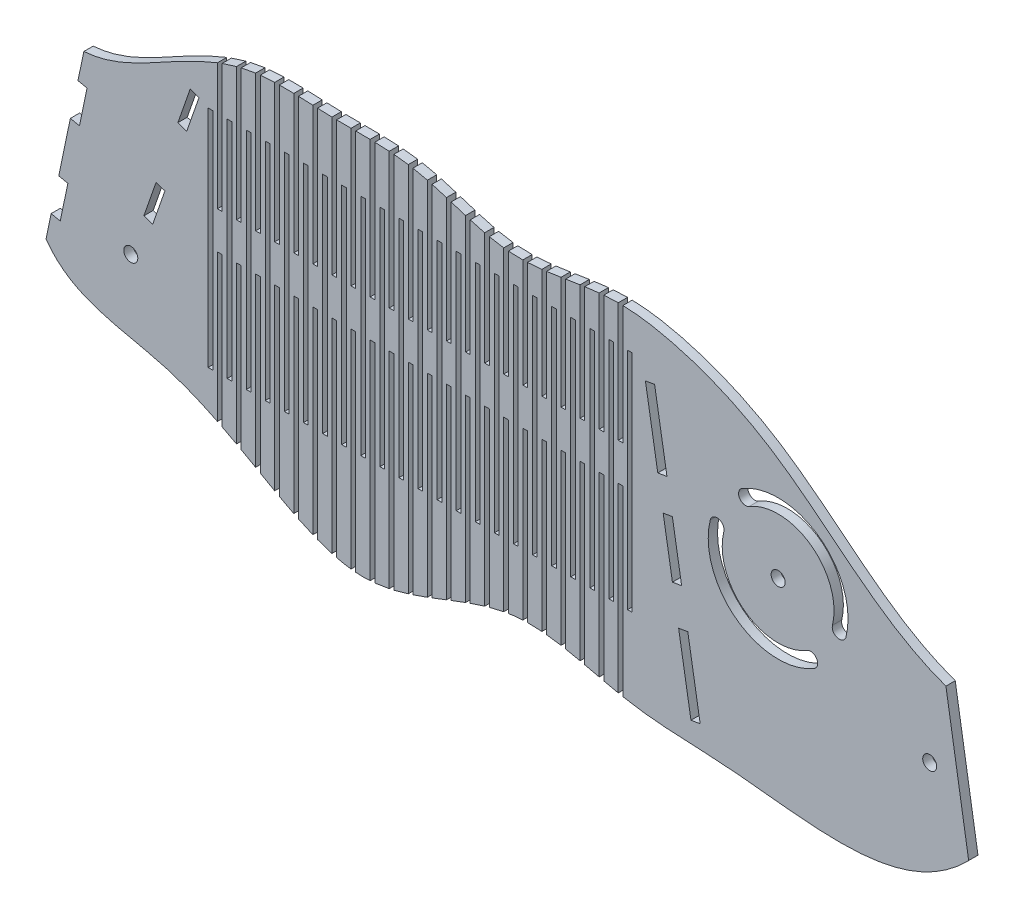
from build123d import *

# Parameters (mm, degrees)
SKETCH1_R           = 2.38125
BOSS_EXTRUDE1_DEPTH = 3.175
CUT_EXTRUDE1_DEPTH  = 5.08
CUT_EXTRUDE2_DEPTH  = 5.08
SKETCH5_R           = 2.38125
CUT_EXTRUDE3_DEPTH  = 3.175
SKETCH6_R           = 2.38125
CUT_EXTRUDE4_DEPTH  = 3.175
CAVITY1_START       = 356.034163388
CAVITY1_OUTLINE_W   = 3.175
CAVITY1_OUTLINE_H   = 3.175
CAVITY1_DEPTH       = 12.7
CAVITY1_START_2     = 391.291479466
CAVITY1_2_OUTLINE_W = 3.175
CAVITY1_2_OUTLINE_H = 3.175
CAVITY1_2_DEPTH     = 12.7
CAVITY2_START       = -223.472188214
CAVITY2_OUTLINE_W   = 3.175
CAVITY2_OUTLINE_H   = 3.175
CAVITY2_DEPTH       = 25.4
CAVITY2_START_2     = -155.235549336
CAVITY2_2_OUTLINE_W = 3.175
CAVITY2_2_OUTLINE_H = 3.175
CAVITY2_2_DEPTH     = 25.4
CAVITY2_START_3     = -186.985549336
CAVITY2_3_OUTLINE_W = 3.175
CAVITY2_3_OUTLINE_H = 3.175
CAVITY2_3_DEPTH     = 19.05
SKETCH9_W           = 1.5875
SKETCH9_H           = 76.537210747
CUT_EXTRUDE5_DEPTH  = 3.175


# Read off the part's stored shape, not the designer's step: Cavity1, Cavity2
with BuildPart() as part:
    # Sketch1 → Boss-Extrude1 (new body)
    with BuildSketch(Plane.XY):
        with BuildLine():
            Line((269.916445409, 253.652399792), (278.652265274, 308.805411772))
            add(Edge.make_bspline(
                [(278.652265274, 308.805411772), (290.692161073, 306.589475047), (311.338850433, 317.335091922), (340.236506307, 333.719378013), (371.054971243, 330.491238026), (400.811790222, 332.322146981), (432.011124299, 316.885943617), (462.237658712, 327.456126434), (492.71380688, 322.24694493), (532.367725491, 304.981517421), (556.314795109, 276.410246833), (580.070243253, 267.986601994)],
                knots=[0, 0, 0, 0, 0.106756345, 0.213119844, 0.299137831, 0.38743389, 0.488570323, 0.604473522, 0.666037588, 0.77282929, 1, 1, 1, 1], degree=3))
            Line((580.070243253, 267.986601994), (587.820428198, 220.400466428))
            add(Edge.make_bspline(
                [(269.916445409, 253.652399792), (277.364011147, 233.640536162), (309.097579981, 234.069368965), (345.25213434, 215.321322945), (385.309708174, 190.516200502), (428.876890705, 223.285910499), (470.617284064, 207.506422317), (522.560085696, 207.927604228), (564.59114382, 196.534310532), (587.820428198, 220.400466428)],
                knots=[0, 0, 0, 0, 0.155676432, 0.249085855, 0.36882305, 0.53529964, 0.647794575, 0.742561856, 1, 1, 1, 1], degree=3))
        make_face()
        with Locations((302.440577305, 256.532151525)):
            Circle(SKETCH1_R, mode=Mode.SUBTRACT)
    extrude(amount=BOSS_EXTRUDE1_DEPTH)

    # Sketch3 → Cut-Extrude1 (cut)
    with BuildSketch(Plane.XY.offset(3.175)):
        with BuildLine():
            Line((273.561406627, 246.609599812), (286.450487232, 308.373338769))
            add(Edge.make_bspline(
                [(286.450487232, 308.373338769), (283.9226769, 308.195649502), (281.329436573, 308.31267975), (278.652265274, 308.805411772)],
                knots=[0.976261836, 0.976261836, 0.976261836, 0.976261836, 1, 1, 1, 1], degree=3))
            Line((278.652265274, 308.805411772), (269.916445409, 253.652399792))
            add(Edge.make_bspline(
                [(269.916445409, 253.652399792), (270.919272736, 250.957768497), (272.146664907, 248.630833297), (273.561406627, 246.609599812)],
                knots=[0, 0, 0, 0, 0.020962095, 0.020962095, 0.020962095, 0.020962095], degree=3))
        make_face()
    extrude(amount=-CUT_EXTRUDE1_DEPTH, mode=Mode.SUBTRACT)

    # Sketch4 → Cut-Extrude2 (cut)
    with BuildSketch(Plane.XY.offset(3.175)):
        Polygon((275.307666463, 254.977577361), (278.415711742, 254.328979222), (281.010104298, 266.761160336), (277.90205902, 267.409758476), align=None)
        Polygon((281.852433987, 286.339729938), (284.960479266, 285.691131799), (287.554871822, 298.123312913), (284.446826544, 298.771911052), align=None)
    extrude(amount=-CUT_EXTRUDE2_DEPTH, mode=Mode.SUBTRACT)

    # Sketch5 → Cut-Extrude3 (cut)
    with BuildSketch(Plane(origin=(0, 0, 0), x_dir=(-1, 0, 0), z_dir=(0, 0, -1))):
        with Locations((-522.920243253, 271.161601994)):
            Circle(SKETCH5_R)
        with BuildLine():
            ThreePointArc((-510.596975391, 291.537377451), (-537.029094713, 290.344288634), (-546.041958521, 265.467619268))
            ThreePointArc((-546.041958521, 265.467619268), (-543.160388722, 263.724846014), (-541.417615468, 266.606415813))
            ThreePointArc((-541.417615468, 266.606415813), (-534.207324421, 286.507751306), (-513.061628964, 287.46222236))
            ThreePointArc((-513.061628964, 287.46222236), (-509.791724632, 288.267473119), (-510.596975391, 291.537377451))
        make_face()
        with BuildLine():
            ThreePointArc((-535.243511114, 250.785826538), (-508.811391792, 251.978915355), (-499.798527984, 276.855584721))
            ThreePointArc((-499.798527984, 276.855584721), (-502.680097784, 278.598357975), (-504.422871038, 275.716788175))
            ThreePointArc((-504.422871038, 275.716788175), (-511.633162084, 255.815452683), (-532.778857542, 254.860981629))
            ThreePointArc((-532.778857542, 254.860981629), (-536.048761874, 254.055730869), (-535.243511114, 250.785826538))
        make_face()
    extrude(amount=-CUT_EXTRUDE3_DEPTH, mode=Mode.SUBTRACT)

    # Sketch6 → Cut-Extrude4 (cut)
    with BuildSketch(Plane.XY.offset(3.175)):
        with Locations((574.544204444, 242.662405338)):
            Circle(SKETCH6_R)
    extrude(amount=-CUT_EXTRUDE4_DEPTH, mode=Mode.SUBTRACT)

    # Cavity1 outline → Cavity1 (cut)
    with BuildSketch(Plane(origin=(0, 0, 0), x_dir=(0.9443237299357901, -0.32901777015863004, 0), z_dir=(0.32901777015863004, 0.9443237299357901, 0)).offset(CAVITY1_START)):
        with Locations((202.520154002, -1.5875)):
            Rectangle(CAVITY1_OUTLINE_W, CAVITY1_OUTLINE_H)
    extrude(amount=CAVITY1_DEPTH, mode=Mode.SUBTRACT)

    # Cavity1 2 outline → Cavity1 2 (cut)
    with BuildSketch(Plane(origin=(0, 0, 0), x_dir=(0.9443237299357901, -0.32901777015863004, 0), z_dir=(0.32901777015863004, 0.9443237299357901, 0)).offset(CAVITY1_START_2)):
        with Locations((202.520154002, -1.5875)):
            Rectangle(CAVITY1_2_OUTLINE_W, CAVITY1_2_OUTLINE_H)
    extrude(amount=CAVITY1_2_DEPTH, mode=Mode.SUBTRACT)

    # Cavity2 outline → Cavity2 (cut)
    with BuildSketch(Plane(origin=(0, 0, 0), x_dir=(0.9861849009695607, 0.165648245084751, 0), z_dir=(0.16564824508475098, -0.9861849009695608, 0)).offset(CAVITY2_START)):
        with Locations((523.537508725, 1.5875)):
            Rectangle(CAVITY2_OUTLINE_W, CAVITY2_OUTLINE_H)
    extrude(amount=CAVITY2_DEPTH, mode=Mode.SUBTRACT)

    # Cavity2 2 outline → Cavity2 2 (cut)
    with BuildSketch(Plane(origin=(0, 0, 0), x_dir=(0.9861849009695607, 0.165648245084751, 0), z_dir=(0.16564824508475098, -0.9861849009695608, 0)).offset(CAVITY2_START_2)):
        with Locations((523.537508725, 1.5875)):
            Rectangle(CAVITY2_2_OUTLINE_W, CAVITY2_2_OUTLINE_H)
    extrude(amount=CAVITY2_2_DEPTH, mode=Mode.SUBTRACT)

    # Cavity2 3 outline → Cavity2 3 (cut)
    with BuildSketch(Plane(origin=(0, 0, 0), x_dir=(0.9861849009695607, 0.165648245084751, 0), z_dir=(0.16564824508475098, -0.9861849009695608, 0)).offset(CAVITY2_START_3)):
        with Locations((523.537508725, 1.5875)):
            Rectangle(CAVITY2_3_OUTLINE_W, CAVITY2_3_OUTLINE_H)
    extrude(amount=CAVITY2_3_DEPTH, mode=Mode.SUBTRACT)

    # Sketch9 → Cut-Extrude5 (cut)
    with BuildSketch(Plane.XY.offset(3.175)):
        with Locations((329.567272583, 274.590734941)):
            Rectangle(SKETCH9_W, SKETCH9_H)
        with BuildLine():
            Line((331.948522583, 272.013398299), (331.948522583, 221.979997018))
            add(Edge.make_bspline(
                [(331.948522583, 221.979997018), (332.478289299, 221.716571812), (333.007376965, 221.449732897), (333.536022583, 221.179701538)],
                knots=[0.212596369, 0.212596369, 0.212596369, 0.212596369, 0.217845379, 0.217845379, 0.217845379, 0.217845379], degree=3))
            Line((333.536022583, 221.179701538), (333.536022583, 272.013398299))
            Line((333.536022583, 272.013398299), (331.948522583, 272.013398299))
        make_face()
        with BuildLine():
            Line((338.44929923, 272.013398299), (338.44929923, 218.58157118))
            add(Edge.make_bspline(
                [(338.44929923, 218.58157118), (338.97809291, 218.293532558), (339.507180303, 218.002981984), (340.03679923, 217.710141493)],
                knots=[0.234125777, 0.234125777, 0.234125777, 0.234125777, 0.239380851, 0.239380851, 0.239380851, 0.239380851], degree=3))
            Line((340.03679923, 217.710141493), (340.03679923, 272.013398299))
            Line((340.03679923, 272.013398299), (338.44929923, 272.013398299))
        make_face()
        with BuildLine():
            Line((344.950075877, 272.013398299), (344.950075877, 214.947650647))
            add(Edge.make_bspline(
                [(344.950075877, 214.947650647), (345.478335911, 214.647238655), (346.007511163, 214.34584242), (346.537575877, 214.04414377)],
                knots=[0.255559988, 0.255559988, 0.255559988, 0.255559988, 0.260751336, 0.260751336, 0.260751336, 0.260751336], degree=3))
            Line((346.537575877, 214.04414377), (346.537575877, 272.013398299))
            Line((346.537575877, 272.013398299), (344.950075877, 272.013398299))
        make_face()
        with BuildLine():
            Line((351.450852523, 272.013398299), (351.450852523, 211.272804214))
            add(Edge.make_bspline(
                [(351.450852523, 211.272804214), (351.979237946, 210.979523007), (352.508412871, 210.687989577), (353.038352523, 210.398859707)],
                knots=[0.27671133, 0.27671133, 0.27671133, 0.27671133, 0.281835714, 0.281835714, 0.281835714, 0.281835714], degree=3))
            Line((353.038352523, 210.398859707), (353.038352523, 272.013398299))
            Line((353.038352523, 272.013398299), (351.450852523, 272.013398299))
        make_face()
        with BuildLine():
            Line((357.95162917, 272.013398299), (357.95162917, 207.817073956))
            add(Edge.make_bspline(
                [(357.95162917, 207.817073956), (358.480130477, 207.55191203), (359.009305131, 207.291074407), (359.53912917, 207.035195351)],
                knots=[0.297604736, 0.297604736, 0.297604736, 0.297604736, 0.302672447, 0.302672447, 0.302672447, 0.302672447], degree=3))
            Line((359.53912917, 207.035195351), (359.53912917, 272.013398299))
            Line((359.53912917, 272.013398299), (357.95162917, 272.013398299))
        make_face()
        with BuildLine():
            Line((364.452405817, 272.013398299), (364.452405817, 204.830553886))
            add(Edge.make_bspline(
                [(364.452405817, 204.830553886), (364.981015372, 204.613285682), (365.510189804, 204.402800939), (366.039905817, 204.199716299)],
                knots=[0.31828075, 0.31828075, 0.31828075, 0.31828075, 0.323301095, 0.323301095, 0.323301095, 0.323301095], degree=3))
            Line((366.039905817, 204.199716299), (366.039905817, 272.013398299))
            Line((366.039905817, 272.013398299), (364.452405817, 272.013398299))
        make_face()
        with BuildLine():
            add(Edge.make_bspline(
                [(331.948522583, 327.781918128), (332.476402121, 327.98584286), (333.005536374, 328.18359917), (333.536022583, 328.374679349)],
                knots=[0.176971561, 0.176971561, 0.176971561, 0.176971561, 0.182261004, 0.182261004, 0.182261004, 0.182261004], degree=3))
            Line((331.948522583, 327.781918128), (331.948522583, 284.713398299))
            Line((331.948522583, 284.713398299), (333.536022583, 284.713398299))
            Line((333.536022583, 284.713398299), (333.536022583, 328.374679349))
        make_face()
        with BuildLine():
            Line((370.953182464, 272.013398299), (370.953182464, 202.550703177))
            add(Edge.make_bspline(
                [(370.953182464, 202.550703177), (371.481894184, 202.400271833), (372.011068437, 202.258998048), (372.540682464, 202.127484268)],
                knots=[0.338776222, 0.338776222, 0.338776222, 0.338776222, 0.343757732, 0.343757732, 0.343757732, 0.343757732], degree=3))
            Line((372.540682464, 202.127484268), (372.540682464, 272.013398299))
            Line((372.540682464, 272.013398299), (370.953182464, 272.013398299))
        make_face()
        with BuildLine():
            add(Edge.make_bspline(
                [(338.44929923, 329.927424416), (338.976859185, 330.069600473), (339.505995572, 330.203911393), (340.03679923, 330.3298829)],
                knots=[0.198455355, 0.198455355, 0.198455355, 0.198455355, 0.203626046, 0.203626046, 0.203626046, 0.203626046], degree=3))
            Line((338.44929923, 329.927424416), (338.44929923, 284.713398299))
            Line((338.44929923, 284.713398299), (340.03679923, 284.713398299))
            Line((340.03679923, 284.713398299), (340.03679923, 330.3298829))
        make_face()
        with BuildLine():
            Line((377.45395911, 272.013398299), (377.45395911, 201.20670015))
            add(Edge.make_bspline(
                [(377.45395911, 201.20670015), (377.982768231, 201.141543243), (378.511942344, 201.087861077), (379.04145911, 201.046244951)],
                knots=[0.359125101, 0.359125101, 0.359125101, 0.359125101, 0.364075702, 0.364075702, 0.364075702, 0.364075702], degree=3))
            Line((379.04145911, 201.046244951), (379.04145911, 272.013398299))
            Line((379.04145911, 272.013398299), (377.45395911, 272.013398299))
        make_face()
        with BuildLine():
            add(Edge.make_bspline(
                [(344.950075877, 331.239502044), (345.477686913, 331.310015282), (346.006892604, 331.372619256), (346.537575877, 331.427980811)],
                knots=[0.219421179, 0.219421179, 0.219421179, 0.219421179, 0.22445911, 0.22445911, 0.22445911, 0.22445911], degree=3))
            Line((344.950075877, 331.239502044), (344.950075877, 284.713398299))
            Line((344.950075877, 284.713398299), (346.537575877, 284.713398299))
            Line((346.537575877, 284.713398299), (346.537575877, 331.427980811))
        make_face()
        with BuildLine():
            Line((383.954735757, 272.013398299), (383.954735757, 201.010740085))
            add(Edge.make_bspline(
                [(383.954735757, 201.010740085), (384.4835923, 201.0432421), (385.012760033, 201.086775203), (385.542235757, 201.14064912)],
                knots=[0.379358514, 0.379358514, 0.379358514, 0.379358514, 0.384284438, 0.384284438, 0.384284438, 0.384284438], degree=3))
            Line((385.542235757, 201.14064912), (385.542235757, 272.013398299))
            Line((385.542235757, 272.013398299), (383.954735757, 272.013398299))
        make_face()
        with BuildLine():
            add(Edge.make_bspline(
                [(351.450852523, 331.751972157), (351.978980116, 331.768895291), (352.508183567, 331.780818892), (353.038352523, 331.788371538)],
                knots=[0.239885944, 0.239885944, 0.239885944, 0.239885944, 0.244825602, 0.244825602, 0.244825602, 0.244825602], degree=3))
            Line((351.450852523, 331.751972157), (351.450852523, 284.713398299))
            Line((351.450852523, 284.713398299), (353.038352523, 284.713398299))
            Line((353.038352523, 284.713398299), (353.038352523, 331.788371538))
        make_face()
        with BuildLine():
            Line((390.455512404, 272.013398299), (390.455512404, 201.915127832))
            add(Edge.make_bspline(
                [(390.455512404, 201.915127832), (390.984384788, 202.025761457), (391.513552507, 202.14452825), (392.043012404, 202.270747538)],
                knots=[0.399494137, 0.399494137, 0.399494137, 0.399494137, 0.404397119, 0.404397119, 0.404397119, 0.404397119], degree=3))
            Line((392.043012404, 202.270747538), (392.043012404, 272.013398299))
            Line((392.043012404, 272.013398299), (390.455512404, 272.013398299))
        make_face()
        with BuildLine():
            add(Edge.make_bspline(
                [(357.95162917, 331.752373778), (358.480220074, 331.739155679), (359.009422206, 331.723557468), (359.53912917, 331.706185191)],
                knots=[0.260009782, 0.260009782, 0.260009782, 0.260009782, 0.264889698, 0.264889698, 0.264889698, 0.264889698], degree=3))
            Line((357.95162917, 331.752373778), (357.95162917, 284.713398299))
            Line((357.95162917, 284.713398299), (359.53912917, 284.713398299))
            Line((359.53912917, 284.713398299), (359.53912917, 331.706185191))
        make_face()
        with BuildLine():
            Line((396.956289051, 272.013398299), (396.956289051, 203.633224381))
            add(Edge.make_bspline(
                [(396.956289051, 203.633224381), (397.485176815, 203.798247993), (398.01434452, 203.96857497), (398.543789051, 204.143533619)],
                knots=[0.419537816, 0.419537816, 0.419537816, 0.419537816, 0.42441914, 0.42441914, 0.42441914, 0.42441914], degree=3))
            Line((398.543789051, 204.143533619), (398.543789051, 272.013398299))
            Line((398.543789051, 272.013398299), (396.956289051, 272.013398299))
        make_face()
        with BuildLine():
            add(Edge.make_bspline(
                [(364.452405817, 331.512565298), (364.981432615, 331.490132848), (365.510634194, 331.467794822), (366.039905817, 331.446147804)],
                knots=[0.279942862, 0.279942862, 0.279942862, 0.279942862, 0.284797248, 0.284797248, 0.284797248, 0.284797248], degree=3))
            Line((364.452405817, 331.512565298), (364.452405817, 284.713398299))
            Line((364.452405817, 284.713398299), (366.039905817, 284.713398299))
            Line((366.039905817, 284.713398299), (366.039905817, 331.446147804))
        make_face()
        with BuildLine():
            Line((403.457065697, 272.013398299), (403.457065697, 205.877321436))
            add(Edge.make_bspline(
                [(403.457065697, 205.877321436), (403.985968416, 206.073657504), (404.515136108, 206.272529414), (405.044565697, 206.473273865)],
                knots=[0.439494736, 0.439494736, 0.439494736, 0.439494736, 0.444355639, 0.444355639, 0.444355639, 0.444355639], degree=3))
            Line((405.044565697, 206.473273865), (405.044565697, 272.013398299))
            Line((405.044565697, 272.013398299), (403.457065697, 272.013398299))
        make_face()
        with BuildLine():
            add(Edge.make_bspline(
                [(370.953182464, 331.282694848), (371.482601919, 331.271002029), (372.01177757, 331.261694939), (372.540682464, 331.254245337)],
                knots=[0.299821824, 0.299821824, 0.299821824, 0.299821824, 0.304682785, 0.304682785, 0.304682785, 0.304682785], degree=3))
            Line((370.953182464, 331.282694848), (370.953182464, 284.713398299))
            Line((370.953182464, 284.713398299), (372.540682464, 284.713398299))
            Line((372.540682464, 284.713398299), (372.540682464, 331.254245337))
        make_face()
        with BuildLine():
            Line((409.957842344, 272.013398299), (409.957842344, 208.367487698))
            add(Edge.make_bspline(
                [(409.957842344, 208.367487698), (410.486759621, 208.572656714), (411.015927301, 208.77765088), (411.545342344, 208.981814737)],
                knots=[0.459369887, 0.459369887, 0.459369887, 0.459369887, 0.464211558, 0.464211558, 0.464211558, 0.464211558], degree=3))
            Line((411.545342344, 208.981814737), (411.545342344, 272.013398299))
            Line((411.545342344, 272.013398299), (409.957842344, 272.013398299))
        make_face()
        with BuildLine():
            add(Edge.make_bspline(
                [(377.45395911, 331.222772669), (377.983492722, 331.221759023), (378.512668505, 331.220966428), (379.04145911, 331.219858884)],
                knots=[0.319761203, 0.319761203, 0.319761203, 0.319761203, 0.32464585, 0.32464585, 0.32464585, 0.32464585], degree=3))
            Line((377.45395911, 331.222772669), (377.45395911, 284.713398299))
            Line((377.45395911, 284.713398299), (379.04145911, 284.713398299))
            Line((379.04145911, 284.713398299), (379.04145911, 331.219858884))
        make_face()
        with BuildLine():
            Line((416.458618991, 272.013398299), (416.458618991, 210.830784546))
            add(Edge.make_bspline(
                [(416.458618991, 210.830784546), (416.987550461, 211.022843739), (417.51671813, 211.212069118), (418.046118991, 211.397812543)],
                knots=[0.479168077, 0.479168077, 0.479168077, 0.479168077, 0.483991666, 0.483991666, 0.483991666, 0.483991666], degree=3))
            Line((418.046118991, 211.397812543), (418.046118991, 272.013398299))
            Line((418.046118991, 272.013398299), (416.458618991, 272.013398299))
        make_face()
        with BuildLine():
            add(Edge.make_bspline(
                [(383.954735757, 331.184394384), (384.48438812, 331.176109504), (385.013564087, 331.165818995), (385.542235757, 331.152976033)],
                knots=[0.339811292, 0.339811292, 0.339811292, 0.339811292, 0.344728592, 0.344728592, 0.344728592, 0.344728592], degree=3))
            Line((383.954735757, 331.184394384), (383.954735757, 284.713398299))
            Line((383.954735757, 284.713398299), (385.542235757, 284.713398299))
            Line((385.542235757, 284.713398299), (385.542235757, 331.152976033))
        make_face()
        with BuildLine():
            Line((422.959395638, 272.013398299), (422.959395638, 213.000537268))
            add(Edge.make_bspline(
                [(422.959395638, 213.000537268), (423.488340962, 213.158023528), (424.01750862, 213.310063953), (424.546895638, 213.456017218)],
                knots=[0.49889395, 0.49889395, 0.49889395, 0.49889395, 0.503700567, 0.503700567, 0.503700567, 0.503700567], degree=3))
            Line((424.546895638, 213.456017218), (424.546895638, 272.013398299))
            Line((424.546895638, 272.013398299), (422.959395638, 272.013398299))
        make_face()
        with BuildLine():
            add(Edge.make_bspline(
                [(390.455512404, 330.942883131), (390.985289809, 330.908603478), (391.514466018, 330.86999874), (392.043012404, 330.82650789)],
                knots=[0.36000967, 0.36000967, 0.36000967, 0.36000967, 0.364969186, 0.364969186, 0.364969186, 0.364969186], degree=3))
            Line((390.455512404, 330.942883131), (390.455512404, 284.713398299))
            Line((390.455512404, 284.713398299), (392.043012404, 284.713398299))
            Line((392.043012404, 284.713398299), (392.043012404, 330.82650789))
        make_face()
        with BuildLine():
            Line((429.460172284, 272.013398299), (429.460172284, 214.615655362))
            add(Edge.make_bspline(
                [(429.460172284, 214.615655362), (429.989131151, 214.717531904), (430.5182988, 214.811393016), (431.047672284, 214.896603718)],
                knots=[0.518551996, 0.518551996, 0.518551996, 0.518551996, 0.523342715, 0.523342715, 0.523342715, 0.523342715], degree=3))
            Line((431.047672284, 214.896603718), (431.047672284, 272.013398299))
            Line((431.047672284, 272.013398299), (429.460172284, 272.013398299))
        make_face()
        with BuildLine():
            add(Edge.make_bspline(
                [(396.956289051, 330.261922888), (397.486199762, 330.181764033), (398.015376277, 330.094832517), (398.543789051, 330.000549278)],
                knots=[0.380396671, 0.380396671, 0.380396671, 0.380396671, 0.385408772, 0.385408772, 0.385408772, 0.385408772], degree=3))
            Line((396.956289051, 330.261922888), (396.956289051, 284.713398299))
            Line((396.956289051, 284.713398299), (398.543789051, 284.713398299))
            Line((398.543789051, 284.713398299), (398.543789051, 330.000549278))
        make_face()
        with BuildLine():
            Line((435.960948931, 272.013398299), (435.960948931, 215.420263651))
            add(Edge.make_bspline(
                [(435.960948931, 215.420263651), (436.489925712, 215.446318858), (437.019095025, 215.462579503), (437.548448931, 215.469678935)],
                knots=[0.538146568, 0.538146568, 0.538146568, 0.538146568, 0.54292249, 0.54292249, 0.54292249, 0.54292249], degree=3))
            Line((437.548448931, 215.469678935), (437.548448931, 272.013398299))
            Line((437.548448931, 272.013398299), (435.960948931, 272.013398299))
        make_face()
        with BuildLine():
            add(Edge.make_bspline(
                [(403.457065697, 328.918054237), (403.986792458, 328.781685295), (404.515933436, 328.64001247), (405.044565697, 328.493947876)],
                knots=[0.401009703, 0.401009703, 0.401009703, 0.401009703, 0.406075263, 0.406075263, 0.406075263, 0.406075263], degree=3))
            Line((403.457065697, 328.918054237), (403.457065697, 284.713398299))
            Line((403.457065697, 284.713398299), (405.044565697, 284.713398299))
            Line((405.044565697, 284.713398299), (405.044565697, 328.493947876))
        make_face()
        with BuildLine():
            Line((442.461725578, 272.013398299), (442.461725578, 215.291669019))
            add(Edge.make_bspline(
                [(442.461725578, 215.291669019), (442.990735656, 215.248304858), (443.519904947, 215.197775196), (444.049225578, 215.140708347)],
                knots=[0.557683428, 0.557683428, 0.557683428, 0.557683428, 0.562446663, 0.562446663, 0.562446663, 0.562446663], degree=3))
            Line((444.049225578, 215.140708347), (444.049225578, 272.013398299))
            Line((444.049225578, 272.013398299), (442.461725578, 272.013398299))
        make_face()
        with BuildLine():
            add(Edge.make_bspline(
                [(409.957842344, 327.033176331), (410.487255497, 326.867629785), (411.016396005, 326.700505435), (411.545342344, 326.532732123)],
                knots=[0.421808556, 0.421808556, 0.421808556, 0.421808556, 0.426904897, 0.426904897, 0.426904897, 0.426904897], degree=3))
            Line((409.957842344, 327.033176331), (409.957842344, 284.713398299))
            Line((409.957842344, 284.713398299), (411.545342344, 284.713398299))
            Line((411.545342344, 284.713398299), (411.545342344, 326.532732123))
        make_face()
        with BuildLine():
            Line((448.962502224, 272.013398299), (448.962502224, 214.442573884))
            add(Edge.make_bspline(
                [(448.962502224, 214.442573884), (449.491545047, 214.351289135), (450.020714321, 214.255429336), (450.550002224, 214.155618764)],
                knots=[0.577172161, 0.577172161, 0.577172161, 0.577172161, 0.581925169, 0.581925169, 0.581925169, 0.581925169], degree=3))
            Line((450.550002224, 214.155618764), (450.550002224, 272.013398299))
            Line((450.550002224, 272.013398299), (448.962502224, 272.013398299))
        make_face()
        with BuildLine():
            add(Edge.make_bspline(
                [(416.458618991, 324.982223021), (416.987710319, 324.81916151), (417.516850738, 324.658333909), (418.046118991, 324.500672201)],
                knots=[0.442694989, 0.442694989, 0.442694989, 0.442694989, 0.447797066, 0.447797066, 0.447797066, 0.447797066], degree=3))
            Line((416.458618991, 324.982223021), (416.458618991, 284.713398299))
            Line((416.458618991, 284.713398299), (418.046118991, 284.713398299))
            Line((418.046118991, 284.713398299), (418.046118991, 324.500672201))
        make_face()
        with BuildLine():
            Line((455.463278871, 272.013398299), (455.463278871, 213.134820257))
            add(Edge.make_bspline(
                [(455.463278871, 213.134820257), (455.992354007, 213.016739909), (456.521523269, 212.89664586), (457.050778871, 212.775159311)],
                knots=[0.596622759, 0.596622759, 0.596622759, 0.596622759, 0.60136795, 0.60136795, 0.60136795, 0.60136795], degree=3))
            Line((457.050778871, 212.775159311), (457.050778871, 272.013398299))
            Line((457.050778871, 272.013398299), (455.463278871, 272.013398299))
        make_face()
        with BuildLine():
            add(Edge.make_bspline(
                [(422.959395638, 323.157092494), (423.488168006, 323.028398131), (424.017308727, 322.905703714), (424.546895638, 322.789930531)],
                knots=[0.463565608, 0.463565608, 0.463565608, 0.463565608, 0.468648094, 0.468648094, 0.468648094, 0.468648094], degree=3))
            Line((422.959395638, 323.157092494), (422.959395638, 284.713398299))
            Line((422.959395638, 284.713398299), (424.546895638, 284.713398299))
            Line((424.546895638, 284.713398299), (424.546895638, 322.789930531))
        make_face()
        with BuildLine():
            Line((461.964055518, 272.013398299), (461.964055518, 211.626286511))
            add(Edge.make_bspline(
                [(461.964055518, 211.626286511), (462.493162652, 211.502271341), (463.022331904, 211.378783857), (463.551555518, 211.256443124)],
                knots=[0.616045023, 0.616045023, 0.616045023, 0.616045023, 0.620784766, 0.620784766, 0.620784766, 0.620784766], degree=3))
            Line((463.551555518, 211.256443124), (463.551555518, 272.013398299))
            Line((463.551555518, 272.013398299), (461.964055518, 272.013398299))
        make_face()
        with BuildLine():
            add(Edge.make_bspline(
                [(429.460172284, 321.943483182), (429.906200433, 321.889650861), (430.43523677, 321.8339657), (430.96501147, 321.788631605), (431.047672284, 321.781808501)],
                knots=[0.48431779, 0.48431779, 0.48431779, 0.48431779, 0.488570323, 0.489356315, 0.489356315, 0.489356315, 0.489356315], degree=3))
            Line((429.460172284, 321.943483182), (429.460172284, 284.713398299))
            Line((429.460172284, 284.713398299), (431.047672284, 284.713398299))
            Line((431.047672284, 284.713398299), (431.047672284, 321.781808501))
        make_face()
        with BuildLine():
            Line((468.464832165, 272.013398299), (468.464832165, 210.172208721))
            add(Edge.make_bspline(
                [(468.464832165, 210.172208721), (468.993971093, 210.062960691), (469.523140341, 209.956770666), (470.052332165, 209.854256494)],
                knots=[0.635448612, 0.635448612, 0.635448612, 0.635448612, 0.640185252, 0.640185252, 0.640185252, 0.640185252], degree=3))
            Line((470.052332165, 209.854256494), (470.052332165, 272.013398299))
            Line((470.052332165, 272.013398299), (468.464832165, 272.013398299))
        make_face()
        with BuildLine():
            add(Edge.make_bspline(
                [(435.960948931, 321.645266952), (436.489532081, 321.656790838), (437.018711697, 321.675921485), (437.548448931, 321.701883188)],
                knots=[0.504866914, 0.504866914, 0.504866914, 0.504866914, 0.509854172, 0.509854172, 0.509854172, 0.509854172], degree=3))
            Line((435.960948931, 321.645266952), (435.960948931, 284.713398299))
            Line((435.960948931, 284.713398299), (437.548448931, 284.713398299))
            Line((437.548448931, 284.713398299), (437.548448931, 321.701883188))
        make_face()
        with BuildLine():
            add(Edge.make_bspline(
                [(442.461725578, 322.113940513), (442.990473675, 322.174181523), (443.519652998, 322.238795215), (444.049225578, 322.307023471)],
                knots=[0.52522669, 0.52522669, 0.52522669, 0.52522669, 0.530175968, 0.530175968, 0.530175968, 0.530175968], degree=3))
            Line((442.461725578, 322.113940513), (442.461725578, 284.713398299))
            Line((442.461725578, 284.713398299), (444.049225578, 284.713398299))
            Line((444.049225578, 284.713398299), (444.049225578, 322.307023471))
        make_face()
        with BuildLine():
            Line((470.052332165, 284.713398299), (470.052332165, 325.244601815))
            add(Edge.make_bspline(
                [(468.464832165, 325.261769939), (468.994213097, 325.263522017), (469.523401733, 325.257691988), (470.052332165, 325.244601815)],
                knots=[0.605800937, 0.605800937, 0.605800937, 0.605800937, 0.61071916, 0.61071916, 0.61071916, 0.61071916], degree=3))
            Line((468.464832165, 325.261769939), (468.464832165, 284.713398299))
            Line((468.464832165, 284.713398299), (470.052332165, 284.713398299))
        make_face()
        with BuildLine():
            add(Edge.make_bspline(
                [(448.962502224, 323.01972757), (449.491408106, 323.102617426), (450.020587235, 323.186769043), (450.550002224, 323.271435933)],
                knots=[0.545450599, 0.545450599, 0.545450599, 0.545450599, 0.550374439, 0.550374439, 0.550374439, 0.550374439], degree=3))
            Line((448.962502224, 323.01972757), (448.962502224, 284.713398299))
            Line((448.962502224, 284.713398299), (450.550002224, 284.713398299))
            Line((450.550002224, 284.713398299), (450.550002224, 323.271435933))
        make_face()
        with BuildLine():
            Line((463.551555518, 284.713398299), (463.551555518, 325.04261189))
            add(Edge.make_bspline(
                [(461.964055518, 324.897310544), (462.493266614, 324.950799344), (463.022445626, 324.999479623), (463.551555518, 325.04261189)],
                knots=[0.585689938, 0.585689938, 0.585689938, 0.585689938, 0.590598345, 0.590598345, 0.590598345, 0.590598345], degree=3))
            Line((461.964055518, 324.897310544), (461.964055518, 284.713398299))
            Line((461.964055518, 284.713398299), (463.551555518, 284.713398299))
        make_face()
        with BuildLine():
            add(Edge.make_bspline(
                [(455.463278871, 324.049025373), (455.992338219, 324.129527625), (456.521517245, 324.208248345), (457.050778871, 324.284447174)],
                knots=[0.565588939, 0.565588939, 0.565588939, 0.565588939, 0.570499263, 0.570499263, 0.570499263, 0.570499263], degree=3))
            Line((455.463278871, 324.049025373), (455.463278871, 284.713398299))
            Line((455.463278871, 284.713398299), (457.050778871, 284.713398299))
            Line((457.050778871, 284.713398299), (457.050778871, 324.284447174))
        make_face()
        with Locations((336.06804923, 274.590734941)):
            Rectangle(SKETCH9_W, SKETCH9_H)
        with Locations((342.568825877, 274.590734941)):
            Rectangle(SKETCH9_W, SKETCH9_H)
        with Locations((349.069602523, 274.590734941)):
            Rectangle(SKETCH9_W, SKETCH9_H)
        with Locations((355.57037917, 274.590734941)):
            Rectangle(SKETCH9_W, SKETCH9_H)
        with Locations((362.071155817, 274.590734941)):
            Rectangle(SKETCH9_W, SKETCH9_H)
        with Locations((368.571932464, 274.590734941)):
            Rectangle(SKETCH9_W, SKETCH9_H)
        with Locations((375.07270911, 274.590734941)):
            Rectangle(SKETCH9_W, SKETCH9_H)
        with Locations((381.573485757, 274.590734941)):
            Rectangle(SKETCH9_W, SKETCH9_H)
        with Locations((388.074262404, 274.590734941)):
            Rectangle(SKETCH9_W, SKETCH9_H)
        with Locations((394.575039051, 274.590734941)):
            Rectangle(SKETCH9_W, SKETCH9_H)
        with Locations((401.075815697, 274.590734941)):
            Rectangle(SKETCH9_W, SKETCH9_H)
        with Locations((407.576592344, 274.590734941)):
            Rectangle(SKETCH9_W, SKETCH9_H)
        with Locations((414.077368991, 274.590734941)):
            Rectangle(SKETCH9_W, SKETCH9_H)
        with Locations((420.578145638, 274.590734941)):
            Rectangle(SKETCH9_W, SKETCH9_H)
        with Locations((427.078922284, 274.590734941)):
            Rectangle(SKETCH9_W, SKETCH9_H)
        with Locations((433.579698931, 274.590734941)):
            Rectangle(SKETCH9_W, SKETCH9_H)
        with Locations((440.080475578, 274.590734941)):
            Rectangle(SKETCH9_W, SKETCH9_H)
        with Locations((446.581252224, 274.590734941)):
            Rectangle(SKETCH9_W, SKETCH9_H)
        with Locations((453.082028871, 274.590734941)):
            Rectangle(SKETCH9_W, SKETCH9_H)
        with Locations((459.582805518, 274.590734941)):
            Rectangle(SKETCH9_W, SKETCH9_H)
        with Locations((466.083582165, 274.590734941)):
            Rectangle(SKETCH9_W, SKETCH9_H)
        with Locations((472.433582165, 274.590734941)):
            Rectangle(SKETCH9_W, SKETCH9_H)
    extrude(amount=-CUT_EXTRUDE5_DEPTH, mode=Mode.SUBTRACT)


solid = part.part
